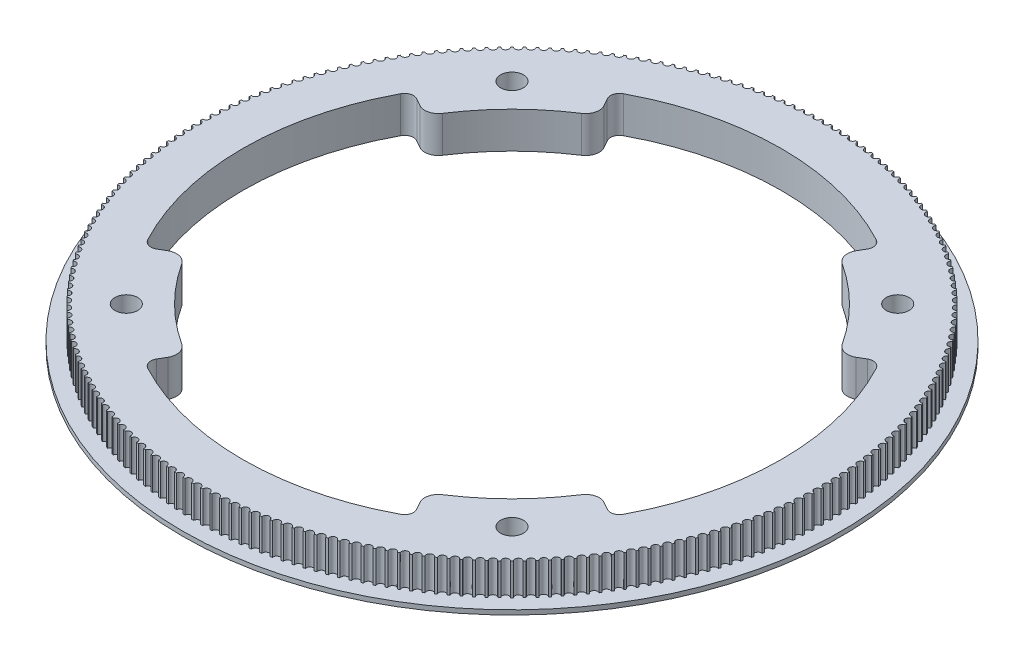
from build123d import *

# Parameters (mm, degrees)
BOSS_EXTRUDE1_DEPTH = 7
SKETCH3_R           = 72.5
BOSS_EXTRUDE3_DEPTH = 1
SKETCH6_R           = 2.5
CUT_EXTRUDE3_DEPTH  = 103.842111997
SKETCH7_R           = 50
CUT_EXTRUDE4_DEPTH  = 103.842111997
CUT_EXTRUDE5_DEPTH  = 103.842111997
SKETCH11_R          = 52.5
CUT_EXTRUDE6_DEPTH  = 10
FILLET1_R           = 3
FILLET2_R           = 2
SKETCH12_R          = 5
CUT_EXTRUDE7_DEPTH  = 3


with BuildPart() as part:
    # Sketch1 → Boss-Extrude1 (new body)
    with BuildSketch(Plane(origin=(0, 0, 0), x_dir=(1, 0, 0), z_dir=(0, 1, 0))):
        with BuildLine():
            ThreePointArc((-0.759988559, 69.250829904), (-0.988925477, 69.247938969), (-1.217851586, 69.244291191))
            ThreePointArc((-1.217851586, 69.244291191), (-1.955946699, 68.467067248), (-2.737208847, 69.200886647))
            ThreePointArc((-2.737208847, 69.200886647), (-2.965969848, 69.191459356), (-3.194698434, 69.18127584))
            ThreePointArc((-3.194698434, 69.18127584), (-3.9102981, 68.383291773), (-4.712196627, 69.094502154))
            ThreePointArc((-4.712196627, 69.094502154), (-4.940595132, 69.078546197), (-5.168939639, 69.061835249))
            ThreePointArc((-5.168939639, 69.061835249), (-5.861460206, 68.243741905), (-6.683341073, 68.931763195))
            ThreePointArc((-6.683341073, 68.931763195), (-6.911190796, 68.909291585), (-7.138964984, 68.886066835))
            ThreePointArc((-7.138964984, 68.886066835), (-7.80784162, 68.048531463), (-8.64903449, 68.7128025))
            ThreePointArc((-8.64903449, 68.7128025), (-8.876149594, 68.683833566), (-9.103167686, 68.654113956))
            ThreePointArc((-9.103167686, 68.654113956), (-9.747854848, 67.797819662), (-10.60767363, 68.437798658))
            ThreePointArc((-10.60767363, 68.437798658), (-10.833868876, 68.402356028), (-11.059945715, 68.366165797))
            ThreePointArc((-11.059945715, 68.366165797), (-11.679917584, 67.491810986), (-12.557660999, 68.106975966))
            ThreePointArc((-12.557660999, 68.106975966), (-12.7827519, 68.065088547), (-13.007703093, 68.022457213))
            ThreePointArc((-13.007703093, 68.022457213), (-13.602454013, 67.130755022), (-14.49740616, 67.720604247))
            ThreePointArc((-14.49740616, 67.720604247), (-14.721209128, 67.672306203), (-14.944851201, 67.623268537))
            ThreePointArc((-14.944851201, 67.623268537), (-15.513896085, 66.714946251), (-16.425327028, 67.278998633))
            ThreePointArc((-16.425327028, 67.278998633), (-16.647659527, 67.224329355), (-16.869810075, 67.168925353))
            ThreePointArc((-16.869810075, 67.168925353), (-17.412684801, 66.244723813), (-18.339851164, 66.782519302))
            ThreePointArc((-18.339851164, 66.782519302), (-18.560531855, 66.721523381), (-18.78100969, 66.65979823))
            ThreePointArc((-18.78100969, 66.65979823), (-19.297271481, 65.720471228), (-20.239417055, 66.23157119))
            ThreePointArc((-20.239417055, 66.23157119), (-20.458265948, 66.164298375), (-20.676891243, 66.096302419))
            ThreePointArc((-20.676891243, 66.096302419), (-21.16611903, 65.142616084), (-22.122475387, 65.626603659))
            ThreePointArc((-22.122475387, 65.626603659), (-22.339313986, 65.553108818), (-22.555908428, 65.478897517))
            ThreePointArc((-22.555908428, 65.478897517), (-23.017703188, 64.511629687), (-23.98749031, 64.968110128))
            ThreePointArc((-23.98749031, 64.968110128), (-24.202141758, 64.888453205), (-24.41652869, 64.808087086))
            ThreePointArc((-24.41652869, 64.808087086), (-24.850513778, 63.828026681), (-25.832940692, 64.256627675))
            ThreePointArc((-25.832940692, 64.256627675), (-26.045229917, 64.170873639), (-26.257234481, 64.08441825))
            ThreePointArc((-26.257234481, 64.08441825), (-26.663055932, 63.09236462), (-27.657321357, 63.492736595))
            ThreePointArc((-27.657321357, 63.492736595), (-27.867075212, 63.400955388), (-28.076524495, 63.308481243))
            ThreePointArc((-28.076524495, 63.308481243), (-28.453851316, 62.305243522), (-29.459144315, 62.677059928))
            ThreePointArc((-29.459144315, 62.677059928), (-29.666191722, 62.579326408), (-29.872914893, 62.48090893))
            ThreePointArc((-29.872914893, 62.48090893), (-30.22143933, 61.467305373), (-31.236939971, 61.810262952))
            ThreePointArc((-31.236939971, 61.810262952), (-31.441112059, 61.706656833), (-31.644940513, 61.602376293))
            ThreePointArc((-31.644940513, 61.602376293), (-31.964378304, 60.579233609), (-32.989258331, 60.893052639))
            ThreePointArc((-32.989258331, 60.893052639), (-33.190388575, 60.783658422), (-33.391156066, 60.673599873))
            ThreePointArc((-33.391156066, 60.673599873), (-33.681246674, 59.641752552), (-34.71467018, 59.926177079))
            ThreePointArc((-34.71467018, 59.926177079), (-34.912594534, 59.811083989), (-35.110137313, 59.695337195))
            ThreePointArc((-35.110137313, 59.695337195), (-35.370644135, 58.655626827), (-36.411768245, 58.910424869))
            ThreePointArc((-36.411768245, 58.910424869), (-36.60632528, 58.789726777), (-36.800482228, 58.668386144))
            ThreePointArc((-36.800482228, 58.668386144), (-37.031192792, 57.621660731), (-38.079168349, 57.846624472))
            ThreePointArc((-38.079168349, 57.846624472), (-38.270199382, 57.72041982), (-38.460812142, 57.593584316))
            ThreePointArc((-38.460812142, 57.593584316), (-38.661538276, 56.540697582), (-39.715510538, 56.735643538))
            ThreePointArc((-39.715510538, 56.735643538), (-39.902859761, 56.604035262), (-40.089772867, 56.471808334))
            ThreePointArc((-40.089772867, 56.471808334), (-40.260350856, 55.41361903), (-41.319460187, 55.5783882))
            ThreePointArc((-41.319460187, 55.5783882), (-41.502974794, 55.44148364), (-41.686035797, 55.303973135))
            ThreePointArc((-41.686035797, 55.303973135), (-41.826326516, 54.241344334), (-42.889709091, 54.375802331))
            ThreePointArc((-42.889709091, 54.375802331), (-43.069239406, 54.233713149), (-43.248298998, 54.091031223))
            ThreePointArc((-43.248298998, 54.091031223), (-43.358188024, 53.024829621), (-44.424976533, 53.128866777))
            ThreePointArc((-44.424976533, 53.128866777), (-44.600376129, 52.981708864), (-44.775288267, 52.833971889))
            ThreePointArc((-44.775288267, 52.833971889), (-44.854685972, 51.765067095), (-45.924010327, 51.838598558))
            ThreePointArc((-45.924010327, 51.838598558), (-46.095136145, 51.686491937), (-46.265758168, 51.533820411))
            ThreePointArc((-46.265758168, 51.533820411), (-46.314599794, 50.463084239), (-47.38558784, 50.506050034))
            ThreePointArc((-47.38558784, 50.506050034), (-47.552300307, 50.349118766), (-47.718493053, 50.191637209))
            ThreePointArc((-47.718493053, 50.191637209), (-47.736738765, 49.119942967), (-48.808516988, 49.132308051))
            ThreePointArc((-48.808516988, 49.132308051), (-48.970680131, 48.970680131), (-49.132308051, 48.808516988))
            ThreePointArc((-49.132308051, 48.808516988), (-49.119942967, 47.736738765), (-50.191637209, 47.718493053))
            ThreePointArc((-50.191637209, 47.718493053), (-50.349118766, 47.552300307), (-50.506050034, 47.38558784))
            ThreePointArc((-50.506050034, 47.38558784), (-50.463084239, 46.314599794), (-51.533820411, 46.265758168))
            ThreePointArc((-51.533820411, 46.265758168), (-51.686491937, 46.095136145), (-51.838598558, 45.924010327))
            ThreePointArc((-51.838598558, 45.924010327), (-51.765067095, 44.854685972), (-52.833971889, 44.775288267))
            ThreePointArc((-52.833971889, 44.775288267), (-52.981708864, 44.600376129), (-53.128866777, 44.424976533))
            ThreePointArc((-53.128866777, 44.424976533), (-53.024829621, 43.358188024), (-54.091031223, 43.248298998))
            ThreePointArc((-54.091031223, 43.248298998), (-54.233713149, 43.069239406), (-54.375802331, 42.889709091))
            ThreePointArc((-54.375802331, 42.889709091), (-54.241344334, 41.826326516), (-55.303973135, 41.686035797))
            ThreePointArc((-55.303973135, 41.686035797), (-55.44148364, 41.502974794), (-55.5783882, 41.319460187))
            ThreePointArc((-55.5783882, 41.319460187), (-55.41361903, 40.260350856), (-56.471808334, 40.089772867))
            ThreePointArc((-56.471808334, 40.089772867), (-56.604035262, 39.902859761), (-56.735643538, 39.715510538))
            ThreePointArc((-56.735643538, 39.715510538), (-56.540697582, 38.661538276), (-57.593584316, 38.460812142))
            ThreePointArc((-57.593584316, 38.460812142), (-57.72041982, 38.270199382), (-57.846624472, 38.079168349))
            ThreePointArc((-57.846624472, 38.079168349), (-57.621660731, 37.031192792), (-58.668386144, 36.800482228))
            ThreePointArc((-58.668386144, 36.800482228), (-58.789726777, 36.60632528), (-58.910424869, 36.411768245))
            ThreePointArc((-58.910424869, 36.411768245), (-58.655626827, 35.370644135), (-59.695337195, 35.110137313))
            ThreePointArc((-59.695337195, 35.110137313), (-59.811083989, 34.912594534), (-59.926177079, 34.71467018))
            ThreePointArc((-59.926177079, 34.71467018), (-59.641752552, 33.681246674), (-60.673599873, 33.391156066))
            ThreePointArc((-60.673599873, 33.391156066), (-60.783658422, 33.190388575), (-60.893052639, 32.989258331))
            ThreePointArc((-60.893052639, 32.989258331), (-60.579233609, 31.964378304), (-61.602376293, 31.644940513))
            ThreePointArc((-61.602376293, 31.644940513), (-61.706656833, 31.441112059), (-61.810262952, 31.236939971))
            ThreePointArc((-61.810262952, 31.236939971), (-61.467305373, 30.22143933), (-62.48090893, 29.872914893))
            ThreePointArc((-62.48090893, 29.872914893), (-62.579326408, 29.666191722), (-62.677059928, 29.459144315))
            ThreePointArc((-62.677059928, 29.459144315), (-62.305243522, 28.453851316), (-63.308481243, 28.076524495))
            ThreePointArc((-63.308481243, 28.076524495), (-63.400955388, 27.867075212), (-63.492736595, 27.657321357))
            ThreePointArc((-63.492736595, 27.657321357), (-63.09236462, 26.663055932), (-64.08441825, 26.257234481))
            ThreePointArc((-64.08441825, 26.257234481), (-64.170873639, 26.045229917), (-64.256627675, 25.832940692))
            ThreePointArc((-64.256627675, 25.832940692), (-63.828026681, 24.850513778), (-64.808087086, 24.41652869))
            ThreePointArc((-64.808087086, 24.41652869), (-64.888453205, 24.202141758), (-64.968110128, 23.98749031))
            ThreePointArc((-64.968110128, 23.98749031), (-64.511629687, 23.017703188), (-65.478897517, 22.555908428))
            ThreePointArc((-65.478897517, 22.555908428), (-65.553108818, 22.339313986), (-65.626603659, 22.122475387))
            ThreePointArc((-65.626603659, 22.122475387), (-65.142616084, 21.16611903), (-66.096302419, 20.676891243))
            ThreePointArc((-66.096302419, 20.676891243), (-66.164298375, 20.458265948), (-66.23157119, 20.239417055))
            ThreePointArc((-66.23157119, 20.239417055), (-65.720471228, 19.297271481), (-66.65979823, 18.78100969))
            ThreePointArc((-66.65979823, 18.78100969), (-66.721523381, 18.560531855), (-66.782519302, 18.339851164))
            ThreePointArc((-66.782519302, 18.339851164), (-66.244723813, 17.412684801), (-67.168925353, 16.869810075))
            ThreePointArc((-67.168925353, 16.869810075), (-67.224329355, 16.647659527), (-67.278998633, 16.425327028))
            ThreePointArc((-67.278998633, 16.425327028), (-66.714946251, 15.513896085), (-67.623268537, 14.944851201))
            ThreePointArc((-67.623268537, 14.944851201), (-67.672306203, 14.721209128), (-67.720604247, 14.49740616))
            ThreePointArc((-67.720604247, 14.49740616), (-67.130755022, 13.602454013), (-68.022457213, 13.007703093))
            ThreePointArc((-68.022457213, 13.007703093), (-68.065088547, 12.7827519), (-68.106975966, 12.557660999))
            ThreePointArc((-68.106975966, 12.557660999), (-67.491810986, 11.679917584), (-68.366165797, 11.059945715))
            ThreePointArc((-68.366165797, 11.059945715), (-68.402356028, 10.833868876), (-68.437798658, 10.60767363))
            ThreePointArc((-68.437798658, 10.60767363), (-67.797819662, 9.747854848), (-68.654113956, 9.103167686))
            ThreePointArc((-68.654113956, 9.103167686), (-68.683833566, 8.876149594), (-68.7128025, 8.64903449))
            ThreePointArc((-68.7128025, 8.64903449), (-68.048531463, 7.80784162), (-68.886066835, 7.138964984))
            ThreePointArc((-68.886066835, 7.138964984), (-68.909291585, 6.911190796), (-68.931763195, 6.683341073))
            ThreePointArc((-68.931763195, 6.683341073), (-68.243741905, 5.861460206), (-69.061835249, 5.168939639))
            ThreePointArc((-69.061835249, 5.168939639), (-69.078546197, 4.940595132), (-69.094502154, 4.712196627))
            ThreePointArc((-69.094502154, 4.712196627), (-68.383291773, 3.9102981), (-69.18127584, 3.194698434))
            ThreePointArc((-69.18127584, 3.194698434), (-69.191459356, 2.965969848), (-69.200886647, 2.737208847))
            ThreePointArc((-69.200886647, 2.737208847), (-68.467067248, 1.955946699), (-69.244291191, 1.217851586))
            ThreePointArc((-69.244291191, 1.217851586), (-69.247938969, 0.988925477), (-69.250829904, 0.759988559))
            ThreePointArc((-69.250829904, 0.759988559), (-68.495, 0), (-69.250829904, -0.759988559))
            ThreePointArc((-69.250829904, -0.759988559), (-69.247938969, -0.988925477), (-69.244291191, -1.217851586))
            ThreePointArc((-69.244291191, -1.217851586), (-68.467067248, -1.955946699), (-69.200886647, -2.737208847))
            ThreePointArc((-69.200886647, -2.737208847), (-69.191459356, -2.965969848), (-69.18127584, -3.194698434))
            ThreePointArc((-69.18127584, -3.194698434), (-68.383291773, -3.9102981), (-69.094502154, -4.712196627))
            ThreePointArc((-69.094502154, -4.712196627), (-69.078546197, -4.940595132), (-69.061835249, -5.168939639))
            ThreePointArc((-69.061835249, -5.168939639), (-68.243741905, -5.861460206), (-68.931763195, -6.683341073))
            ThreePointArc((-68.931763195, -6.683341073), (-68.909291585, -6.911190796), (-68.886066835, -7.138964984))
            ThreePointArc((-68.886066835, -7.138964984), (-68.048531463, -7.80784162), (-68.7128025, -8.64903449))
            ThreePointArc((-68.7128025, -8.64903449), (-68.683833566, -8.876149594), (-68.654113956, -9.103167686))
            ThreePointArc((-68.654113956, -9.103167686), (-67.797819662, -9.747854848), (-68.437798658, -10.60767363))
            ThreePointArc((-68.437798658, -10.60767363), (-68.402356028, -10.833868876), (-68.366165797, -11.059945715))
            ThreePointArc((-68.366165797, -11.059945715), (-67.491810986, -11.679917584), (-68.106975966, -12.557660999))
            ThreePointArc((-68.106975966, -12.557660999), (-68.065088547, -12.7827519), (-68.022457213, -13.007703093))
            ThreePointArc((-68.022457213, -13.007703093), (-67.130755022, -13.602454013), (-67.720604247, -14.49740616))
            ThreePointArc((-67.720604247, -14.49740616), (-67.672306203, -14.721209128), (-67.623268537, -14.944851201))
            ThreePointArc((-67.623268537, -14.944851201), (-66.714946251, -15.513896085), (-67.278998633, -16.425327028))
            ThreePointArc((-67.278998633, -16.425327028), (-67.224329355, -16.647659527), (-67.168925353, -16.869810075))
            ThreePointArc((-67.168925353, -16.869810075), (-66.244723813, -17.412684801), (-66.782519302, -18.339851164))
            ThreePointArc((-66.782519302, -18.339851164), (-66.721523381, -18.560531855), (-66.65979823, -18.78100969))
            ThreePointArc((-66.65979823, -18.78100969), (-65.720471228, -19.297271481), (-66.23157119, -20.239417055))
            ThreePointArc((-66.23157119, -20.239417055), (-66.164298375, -20.458265948), (-66.096302419, -20.676891243))
            ThreePointArc((-66.096302419, -20.676891243), (-65.142616084, -21.16611903), (-65.626603659, -22.122475387))
            ThreePointArc((-65.626603659, -22.122475387), (-65.553108818, -22.339313986), (-65.478897517, -22.555908428))
            ThreePointArc((-65.478897517, -22.555908428), (-64.511629687, -23.017703188), (-64.968110128, -23.98749031))
            ThreePointArc((-64.968110128, -23.98749031), (-64.888453205, -24.202141758), (-64.808087086, -24.41652869))
            ThreePointArc((-64.808087086, -24.41652869), (-63.828026681, -24.850513778), (-64.256627675, -25.832940692))
            ThreePointArc((-64.256627675, -25.832940692), (-64.170873639, -26.045229917), (-64.08441825, -26.257234481))
            ThreePointArc((-64.08441825, -26.257234481), (-63.09236462, -26.663055932), (-63.492736595, -27.657321357))
            ThreePointArc((-63.492736595, -27.657321357), (-63.400955388, -27.867075212), (-63.308481243, -28.076524495))
            ThreePointArc((-63.308481243, -28.076524495), (-62.305243522, -28.453851316), (-62.677059928, -29.459144315))
            ThreePointArc((-62.677059928, -29.459144315), (-62.579326408, -29.666191722), (-62.48090893, -29.872914893))
            ThreePointArc((-62.48090893, -29.872914893), (-61.467305373, -30.22143933), (-61.810262952, -31.236939971))
            ThreePointArc((-61.810262952, -31.236939971), (-61.706656833, -31.441112059), (-61.602376293, -31.644940513))
            ThreePointArc((-61.602376293, -31.644940513), (-60.579233609, -31.964378304), (-60.893052639, -32.989258331))
            ThreePointArc((-60.893052639, -32.989258331), (-60.783658422, -33.190388575), (-60.673599873, -33.391156066))
            ThreePointArc((-60.673599873, -33.391156066), (-59.641752552, -33.681246674), (-59.926177079, -34.71467018))
            ThreePointArc((-59.926177079, -34.71467018), (-59.811083989, -34.912594534), (-59.695337195, -35.110137313))
            ThreePointArc((-59.695337195, -35.110137313), (-58.655626827, -35.370644135), (-58.910424869, -36.411768245))
            ThreePointArc((-58.910424869, -36.411768245), (-58.789726777, -36.60632528), (-58.668386144, -36.800482228))
            ThreePointArc((-58.668386144, -36.800482228), (-57.621660731, -37.031192792), (-57.846624472, -38.079168349))
            ThreePointArc((-57.846624472, -38.079168349), (-57.72041982, -38.270199382), (-57.593584316, -38.460812142))
            ThreePointArc((-57.593584316, -38.460812142), (-56.540697582, -38.661538276), (-56.735643538, -39.715510538))
            ThreePointArc((-56.735643538, -39.715510538), (-56.604035262, -39.902859761), (-56.471808334, -40.089772867))
            ThreePointArc((-56.471808334, -40.089772867), (-55.41361903, -40.260350856), (-55.5783882, -41.319460187))
            ThreePointArc((-55.5783882, -41.319460187), (-55.44148364, -41.502974794), (-55.303973135, -41.686035797))
            ThreePointArc((-55.303973135, -41.686035797), (-54.241344334, -41.826326516), (-54.375802331, -42.889709091))
            ThreePointArc((-54.375802331, -42.889709091), (-54.233713149, -43.069239406), (-54.091031223, -43.248298998))
            ThreePointArc((-54.091031223, -43.248298998), (-53.024829621, -43.358188024), (-53.128866777, -44.424976533))
            ThreePointArc((-53.128866777, -44.424976533), (-52.981708864, -44.600376129), (-52.833971889, -44.775288267))
            ThreePointArc((-52.833971889, -44.775288267), (-51.765067095, -44.854685972), (-51.838598558, -45.924010327))
            ThreePointArc((-51.838598558, -45.924010327), (-51.686491937, -46.095136145), (-51.533820411, -46.265758168))
            ThreePointArc((-51.533820411, -46.265758168), (-50.463084239, -46.314599794), (-50.506050034, -47.38558784))
            ThreePointArc((-50.506050034, -47.38558784), (-50.349118766, -47.552300307), (-50.191637209, -47.718493053))
            ThreePointArc((-50.191637209, -47.718493053), (-49.119942967, -47.736738765), (-49.132308051, -48.808516988))
            ThreePointArc((-49.132308051, -48.808516988), (-48.970680131, -48.970680131), (-48.808516988, -49.132308051))
            ThreePointArc((-48.808516988, -49.132308051), (-47.736738765, -49.119942967), (-47.718493053, -50.191637209))
            ThreePointArc((-47.718493053, -50.191637209), (-47.552300307, -50.349118766), (-47.38558784, -50.506050034))
            ThreePointArc((-47.38558784, -50.506050034), (-46.314599794, -50.463084239), (-46.265758168, -51.533820411))
            ThreePointArc((-46.265758168, -51.533820411), (-46.095136145, -51.686491937), (-45.924010327, -51.838598558))
            ThreePointArc((-45.924010327, -51.838598558), (-44.854685972, -51.765067095), (-44.775288267, -52.833971889))
            ThreePointArc((-44.775288267, -52.833971889), (-44.600376129, -52.981708864), (-44.424976533, -53.128866777))
            ThreePointArc((-44.424976533, -53.128866777), (-43.358188024, -53.024829621), (-43.248298998, -54.091031223))
            ThreePointArc((-43.248298998, -54.091031223), (-43.069239406, -54.233713149), (-42.889709091, -54.375802331))
            ThreePointArc((-42.889709091, -54.375802331), (-41.826326516, -54.241344334), (-41.686035797, -55.303973135))
            ThreePointArc((-41.686035797, -55.303973135), (-41.502974794, -55.44148364), (-41.319460187, -55.5783882))
            ThreePointArc((-41.319460187, -55.5783882), (-40.260350856, -55.41361903), (-40.089772867, -56.471808334))
            ThreePointArc((-40.089772867, -56.471808334), (-39.902859761, -56.604035262), (-39.715510538, -56.735643538))
            ThreePointArc((-39.715510538, -56.735643538), (-38.661538276, -56.540697582), (-38.460812142, -57.593584316))
            ThreePointArc((-38.460812142, -57.593584316), (-38.270199382, -57.72041982), (-38.079168349, -57.846624472))
            ThreePointArc((-38.079168349, -57.846624472), (-37.031192792, -57.621660731), (-36.800482228, -58.668386144))
            ThreePointArc((-36.800482228, -58.668386144), (-36.60632528, -58.789726777), (-36.411768245, -58.910424869))
            ThreePointArc((-36.411768245, -58.910424869), (-35.370644135, -58.655626827), (-35.110137313, -59.695337195))
            ThreePointArc((-35.110137313, -59.695337195), (-34.912594534, -59.811083989), (-34.71467018, -59.926177079))
            ThreePointArc((-34.71467018, -59.926177079), (-33.681246674, -59.641752552), (-33.391156066, -60.673599873))
            ThreePointArc((-33.391156066, -60.673599873), (-33.190388575, -60.783658422), (-32.989258331, -60.893052639))
            ThreePointArc((-32.989258331, -60.893052639), (-31.964378304, -60.579233609), (-31.644940513, -61.602376293))
            ThreePointArc((-31.644940513, -61.602376293), (-31.441112059, -61.706656833), (-31.236939971, -61.810262952))
            ThreePointArc((-31.236939971, -61.810262952), (-30.22143933, -61.467305373), (-29.872914893, -62.48090893))
            ThreePointArc((-29.872914893, -62.48090893), (-29.666191722, -62.579326408), (-29.459144315, -62.677059928))
            ThreePointArc((-29.459144315, -62.677059928), (-28.453851316, -62.305243522), (-28.076524495, -63.308481243))
            ThreePointArc((-28.076524495, -63.308481243), (-27.867075212, -63.400955388), (-27.657321357, -63.492736595))
            ThreePointArc((-27.657321357, -63.492736595), (-26.663055932, -63.09236462), (-26.257234481, -64.08441825))
            ThreePointArc((-26.257234481, -64.08441825), (-26.045229917, -64.170873639), (-25.832940692, -64.256627675))
            ThreePointArc((-25.832940692, -64.256627675), (-24.850513778, -63.828026681), (-24.41652869, -64.808087086))
            ThreePointArc((-24.41652869, -64.808087086), (-24.202141758, -64.888453205), (-23.98749031, -64.968110128))
            ThreePointArc((-23.98749031, -64.968110128), (-23.017703188, -64.511629687), (-22.555908428, -65.478897517))
            ThreePointArc((-22.555908428, -65.478897517), (-22.339313986, -65.553108818), (-22.122475387, -65.626603659))
            ThreePointArc((-22.122475387, -65.626603659), (-21.16611903, -65.142616084), (-20.676891243, -66.096302419))
            ThreePointArc((-20.676891243, -66.096302419), (-20.458265948, -66.164298375), (-20.239417055, -66.23157119))
            ThreePointArc((-20.239417055, -66.23157119), (-19.297271481, -65.720471228), (-18.78100969, -66.65979823))
            ThreePointArc((-18.78100969, -66.65979823), (-18.560531855, -66.721523381), (-18.339851164, -66.782519302))
            ThreePointArc((-18.339851164, -66.782519302), (-17.412684801, -66.244723813), (-16.869810075, -67.168925353))
            ThreePointArc((-16.869810075, -67.168925353), (-16.647659527, -67.224329355), (-16.425327028, -67.278998633))
            ThreePointArc((-16.425327028, -67.278998633), (-15.513896085, -66.714946251), (-14.944851201, -67.623268537))
            ThreePointArc((-14.944851201, -67.623268537), (-14.721209128, -67.672306203), (-14.49740616, -67.720604247))
            ThreePointArc((-14.49740616, -67.720604247), (-13.602454013, -67.130755022), (-13.007703093, -68.022457213))
            ThreePointArc((-13.007703093, -68.022457213), (-12.7827519, -68.065088547), (-12.557660999, -68.106975966))
            ThreePointArc((-12.557660999, -68.106975966), (-11.679917584, -67.491810986), (-11.059945715, -68.366165797))
            ThreePointArc((-11.059945715, -68.366165797), (-10.833868876, -68.402356028), (-10.60767363, -68.437798658))
            ThreePointArc((-10.60767363, -68.437798658), (-9.747854848, -67.797819662), (-9.103167686, -68.654113956))
            ThreePointArc((-9.103167686, -68.654113956), (-8.876149594, -68.683833566), (-8.64903449, -68.7128025))
            ThreePointArc((-8.64903449, -68.7128025), (-7.80784162, -68.048531463), (-7.138964984, -68.886066835))
            ThreePointArc((-7.138964984, -68.886066835), (-6.911190796, -68.909291585), (-6.683341073, -68.931763195))
            ThreePointArc((-6.683341073, -68.931763195), (-5.861460206, -68.243741905), (-5.168939639, -69.061835249))
            ThreePointArc((-5.168939639, -69.061835249), (-4.940595132, -69.078546197), (-4.712196627, -69.094502154))
            ThreePointArc((-4.712196627, -69.094502154), (-3.9102981, -68.383291773), (-3.194698434, -69.18127584))
            ThreePointArc((-3.194698434, -69.18127584), (-2.965969848, -69.191459356), (-2.737208847, -69.200886647))
            ThreePointArc((-2.737208847, -69.200886647), (-1.955946699, -68.467067248), (-1.217851586, -69.244291191))
            ThreePointArc((-1.217851586, -69.244291191), (-0.988925477, -69.247938969), (-0.759988559, -69.250829904))
            ThreePointArc((-0.759988559, -69.250829904), (0, -68.495), (0.759988559, -69.250829904))
            ThreePointArc((0.759988559, -69.250829904), (0.988925477, -69.247938969), (1.217851586, -69.244291191))
            ThreePointArc((1.217851586, -69.244291191), (1.955946699, -68.467067248), (2.737208847, -69.200886647))
            ThreePointArc((2.737208847, -69.200886647), (2.965969848, -69.191459356), (3.194698434, -69.18127584))
            ThreePointArc((3.194698434, -69.18127584), (3.9102981, -68.383291773), (4.712196627, -69.094502154))
            ThreePointArc((4.712196627, -69.094502154), (4.940595132, -69.078546197), (5.168939639, -69.061835249))
            ThreePointArc((5.168939639, -69.061835249), (5.861460206, -68.243741905), (6.683341073, -68.931763195))
            ThreePointArc((6.683341073, -68.931763195), (6.911190796, -68.909291585), (7.138964984, -68.886066835))
            ThreePointArc((7.138964984, -68.886066835), (7.80784162, -68.048531463), (8.64903449, -68.7128025))
            ThreePointArc((8.64903449, -68.7128025), (8.876149594, -68.683833566), (9.103167686, -68.654113956))
            ThreePointArc((9.103167686, -68.654113956), (9.747854848, -67.797819662), (10.60767363, -68.437798658))
            ThreePointArc((10.60767363, -68.437798658), (10.833868876, -68.402356028), (11.059945715, -68.366165797))
            ThreePointArc((11.059945715, -68.366165797), (11.679917584, -67.491810986), (12.557660999, -68.106975966))
            ThreePointArc((12.557660999, -68.106975966), (12.7827519, -68.065088547), (13.007703093, -68.022457213))
            ThreePointArc((13.007703093, -68.022457213), (13.602454013, -67.130755022), (14.49740616, -67.720604247))
            ThreePointArc((14.49740616, -67.720604247), (14.721209128, -67.672306203), (14.944851201, -67.623268537))
            ThreePointArc((14.944851201, -67.623268537), (15.513896085, -66.714946251), (16.425327028, -67.278998633))
            ThreePointArc((16.425327028, -67.278998633), (16.647659527, -67.224329355), (16.869810075, -67.168925353))
            ThreePointArc((16.869810075, -67.168925353), (17.412684801, -66.244723813), (18.339851164, -66.782519302))
            ThreePointArc((18.339851164, -66.782519302), (18.560531855, -66.721523381), (18.78100969, -66.65979823))
            ThreePointArc((18.78100969, -66.65979823), (19.297271481, -65.720471228), (20.239417055, -66.23157119))
            ThreePointArc((20.239417055, -66.23157119), (20.458265948, -66.164298375), (20.676891243, -66.096302419))
            ThreePointArc((20.676891243, -66.096302419), (21.16611903, -65.142616084), (22.122475387, -65.626603659))
            ThreePointArc((22.122475387, -65.626603659), (22.339313986, -65.553108818), (22.555908428, -65.478897517))
            ThreePointArc((22.555908428, -65.478897517), (23.017703188, -64.511629687), (23.98749031, -64.968110128))
            ThreePointArc((23.98749031, -64.968110128), (24.202141758, -64.888453205), (24.41652869, -64.808087086))
            ThreePointArc((24.41652869, -64.808087086), (24.850513778, -63.828026681), (25.832940692, -64.256627675))
            ThreePointArc((25.832940692, -64.256627675), (26.045229917, -64.170873639), (26.257234481, -64.08441825))
            ThreePointArc((26.257234481, -64.08441825), (26.663055932, -63.09236462), (27.657321357, -63.492736595))
            ThreePointArc((27.657321357, -63.492736595), (27.867075212, -63.400955388), (28.076524495, -63.308481243))
            ThreePointArc((28.076524495, -63.308481243), (28.453851316, -62.305243522), (29.459144315, -62.677059928))
            ThreePointArc((29.459144315, -62.677059928), (29.666191722, -62.579326408), (29.872914893, -62.48090893))
            ThreePointArc((29.872914893, -62.48090893), (30.22143933, -61.467305373), (31.236939971, -61.810262952))
            ThreePointArc((31.236939971, -61.810262952), (31.441112059, -61.706656833), (31.644940513, -61.602376293))
            ThreePointArc((31.644940513, -61.602376293), (31.964378304, -60.579233609), (32.989258331, -60.893052639))
            ThreePointArc((32.989258331, -60.893052639), (33.190388575, -60.783658422), (33.391156066, -60.673599873))
            ThreePointArc((33.391156066, -60.673599873), (33.681246674, -59.641752552), (34.71467018, -59.926177079))
            ThreePointArc((34.71467018, -59.926177079), (34.912594534, -59.811083989), (35.110137313, -59.695337195))
            ThreePointArc((35.110137313, -59.695337195), (35.370644135, -58.655626827), (36.411768245, -58.910424869))
            ThreePointArc((36.411768245, -58.910424869), (36.60632528, -58.789726777), (36.800482228, -58.668386144))
            ThreePointArc((36.800482228, -58.668386144), (37.031192792, -57.621660731), (38.079168349, -57.846624472))
            ThreePointArc((38.079168349, -57.846624472), (38.270199382, -57.72041982), (38.460812142, -57.593584316))
            ThreePointArc((38.460812142, -57.593584316), (38.661538276, -56.540697582), (39.715510538, -56.735643538))
            ThreePointArc((39.715510538, -56.735643538), (39.902859761, -56.604035262), (40.089772867, -56.471808334))
            ThreePointArc((40.089772867, -56.471808334), (40.260350856, -55.41361903), (41.319460187, -55.5783882))
            ThreePointArc((41.319460187, -55.5783882), (41.502974794, -55.44148364), (41.686035797, -55.303973135))
            ThreePointArc((41.686035797, -55.303973135), (41.826326516, -54.241344334), (42.889709091, -54.375802331))
            ThreePointArc((42.889709091, -54.375802331), (43.069239406, -54.233713149), (43.248298998, -54.091031223))
            ThreePointArc((43.248298998, -54.091031223), (43.358188024, -53.024829621), (44.424976533, -53.128866777))
            ThreePointArc((44.424976533, -53.128866777), (44.600376129, -52.981708864), (44.775288267, -52.833971889))
            ThreePointArc((44.775288267, -52.833971889), (44.854685972, -51.765067095), (45.924010327, -51.838598558))
            ThreePointArc((45.924010327, -51.838598558), (46.095136145, -51.686491937), (46.265758168, -51.533820411))
            ThreePointArc((46.265758168, -51.533820411), (46.314599794, -50.463084239), (47.38558784, -50.506050034))
            ThreePointArc((47.38558784, -50.506050034), (47.552300307, -50.349118766), (47.718493053, -50.191637209))
            ThreePointArc((47.718493053, -50.191637209), (47.736738765, -49.119942967), (48.808516988, -49.132308051))
            ThreePointArc((48.808516988, -49.132308051), (48.970680131, -48.970680131), (49.132308051, -48.808516988))
            ThreePointArc((49.132308051, -48.808516988), (49.119942967, -47.736738765), (50.191637209, -47.718493053))
            ThreePointArc((50.191637209, -47.718493053), (50.349118766, -47.552300307), (50.506050034, -47.38558784))
            ThreePointArc((50.506050034, -47.38558784), (50.463084239, -46.314599794), (51.533820411, -46.265758168))
            ThreePointArc((51.533820411, -46.265758168), (51.686491937, -46.095136145), (51.838598558, -45.924010327))
            ThreePointArc((51.838598558, -45.924010327), (51.765067095, -44.854685972), (52.833971889, -44.775288267))
            ThreePointArc((52.833971889, -44.775288267), (52.981708864, -44.600376129), (53.128866777, -44.424976533))
            ThreePointArc((53.128866777, -44.424976533), (53.024829621, -43.358188024), (54.091031223, -43.248298998))
            ThreePointArc((54.091031223, -43.248298998), (54.233713149, -43.069239406), (54.375802331, -42.889709091))
            ThreePointArc((54.375802331, -42.889709091), (54.241344334, -41.826326516), (55.303973135, -41.686035797))
            ThreePointArc((55.303973135, -41.686035797), (55.44148364, -41.502974794), (55.5783882, -41.319460187))
            ThreePointArc((55.5783882, -41.319460187), (55.41361903, -40.260350856), (56.471808334, -40.089772867))
            ThreePointArc((56.471808334, -40.089772867), (56.604035262, -39.902859761), (56.735643538, -39.715510538))
            ThreePointArc((56.735643538, -39.715510538), (56.540697582, -38.661538276), (57.593584316, -38.460812142))
            ThreePointArc((57.593584316, -38.460812142), (57.72041982, -38.270199382), (57.846624472, -38.079168349))
            ThreePointArc((57.846624472, -38.079168349), (57.621660731, -37.031192792), (58.668386144, -36.800482228))
            ThreePointArc((58.668386144, -36.800482228), (58.789726777, -36.60632528), (58.910424869, -36.411768245))
            ThreePointArc((58.910424869, -36.411768245), (58.655626827, -35.370644135), (59.695337195, -35.110137313))
            ThreePointArc((59.695337195, -35.110137313), (59.811083989, -34.912594534), (59.926177079, -34.71467018))
            ThreePointArc((59.926177079, -34.71467018), (59.641752552, -33.681246674), (60.673599873, -33.391156066))
            ThreePointArc((60.673599873, -33.391156066), (60.783658422, -33.190388575), (60.893052639, -32.989258331))
            ThreePointArc((60.893052639, -32.989258331), (60.579233609, -31.964378304), (61.602376293, -31.644940513))
            ThreePointArc((61.602376293, -31.644940513), (61.706656833, -31.441112059), (61.810262952, -31.236939971))
            ThreePointArc((61.810262952, -31.236939971), (61.467305373, -30.22143933), (62.48090893, -29.872914893))
            ThreePointArc((62.48090893, -29.872914893), (62.579326408, -29.666191722), (62.677059928, -29.459144315))
            ThreePointArc((62.677059928, -29.459144315), (62.305243522, -28.453851316), (63.308481243, -28.076524495))
            ThreePointArc((63.308481243, -28.076524495), (63.400955388, -27.867075212), (63.492736595, -27.657321357))
            ThreePointArc((63.492736595, -27.657321357), (63.09236462, -26.663055932), (64.08441825, -26.257234481))
            ThreePointArc((64.08441825, -26.257234481), (64.170873639, -26.045229917), (64.256627675, -25.832940692))
            ThreePointArc((64.256627675, -25.832940692), (63.828026681, -24.850513778), (64.808087086, -24.41652869))
            ThreePointArc((64.808087086, -24.41652869), (64.888453205, -24.202141758), (64.968110128, -23.98749031))
            ThreePointArc((64.968110128, -23.98749031), (64.511629687, -23.017703188), (65.478897517, -22.555908428))
            ThreePointArc((65.478897517, -22.555908428), (65.553108818, -22.339313986), (65.626603659, -22.122475387))
            ThreePointArc((65.626603659, -22.122475387), (65.142616084, -21.16611903), (66.096302419, -20.676891243))
            ThreePointArc((66.096302419, -20.676891243), (66.164298375, -20.458265948), (66.23157119, -20.239417055))
            ThreePointArc((66.23157119, -20.239417055), (65.720471228, -19.297271481), (66.65979823, -18.78100969))
            ThreePointArc((66.65979823, -18.78100969), (66.721523381, -18.560531855), (66.782519302, -18.339851164))
            ThreePointArc((66.782519302, -18.339851164), (66.244723813, -17.412684801), (67.168925353, -16.869810075))
            ThreePointArc((67.168925353, -16.869810075), (67.224329355, -16.647659527), (67.278998633, -16.425327028))
            ThreePointArc((67.278998633, -16.425327028), (66.714946251, -15.513896085), (67.623268537, -14.944851201))
            ThreePointArc((67.623268537, -14.944851201), (67.672306203, -14.721209128), (67.720604247, -14.49740616))
            ThreePointArc((67.720604247, -14.49740616), (67.130755022, -13.602454013), (68.022457213, -13.007703093))
            ThreePointArc((68.022457213, -13.007703093), (68.065088547, -12.7827519), (68.106975966, -12.557660999))
            ThreePointArc((68.106975966, -12.557660999), (67.491810986, -11.679917584), (68.366165797, -11.059945715))
            ThreePointArc((68.366165797, -11.059945715), (68.402356028, -10.833868876), (68.437798658, -10.60767363))
            ThreePointArc((68.437798658, -10.60767363), (67.797819662, -9.747854848), (68.654113956, -9.103167686))
            ThreePointArc((68.654113956, -9.103167686), (68.683833566, -8.876149594), (68.7128025, -8.64903449))
            ThreePointArc((68.7128025, -8.64903449), (68.048531463, -7.80784162), (68.886066835, -7.138964984))
            ThreePointArc((68.886066835, -7.138964984), (68.909291585, -6.911190796), (68.931763195, -6.683341073))
            ThreePointArc((68.931763195, -6.683341073), (68.243741905, -5.861460206), (69.061835249, -5.168939639))
            ThreePointArc((69.061835249, -5.168939639), (69.078546197, -4.940595132), (69.094502154, -4.712196627))
            ThreePointArc((69.094502154, -4.712196627), (68.383291773, -3.9102981), (69.18127584, -3.194698434))
            ThreePointArc((69.18127584, -3.194698434), (69.191459356, -2.965969848), (69.200886647, -2.737208847))
            ThreePointArc((69.200886647, -2.737208847), (68.467067248, -1.955946699), (69.244291191, -1.217851586))
            ThreePointArc((69.244291191, -1.217851586), (69.247938969, -0.988925477), (69.250829904, -0.759988559))
            ThreePointArc((69.250829904, -0.759988559), (68.495, 0), (69.250829904, 0.759988559))
            ThreePointArc((69.250829904, 0.759988559), (69.247938969, 0.988925477), (69.244291191, 1.217851586))
            ThreePointArc((69.244291191, 1.217851586), (68.467067248, 1.955946699), (69.200886647, 2.737208847))
            ThreePointArc((69.200886647, 2.737208847), (69.191459356, 2.965969848), (69.18127584, 3.194698434))
            ThreePointArc((69.18127584, 3.194698434), (68.383291773, 3.9102981), (69.094502154, 4.712196627))
            ThreePointArc((69.094502154, 4.712196627), (69.078546197, 4.940595132), (69.061835249, 5.168939639))
            ThreePointArc((69.061835249, 5.168939639), (68.243741905, 5.861460206), (68.931763195, 6.683341073))
            ThreePointArc((68.931763195, 6.683341073), (68.909291585, 6.911190796), (68.886066835, 7.138964984))
            ThreePointArc((68.886066835, 7.138964984), (68.048531463, 7.80784162), (68.7128025, 8.64903449))
            ThreePointArc((68.7128025, 8.64903449), (68.683833566, 8.876149594), (68.654113956, 9.103167686))
            ThreePointArc((68.654113956, 9.103167686), (67.797819662, 9.747854848), (68.437798658, 10.60767363))
            ThreePointArc((68.437798658, 10.60767363), (68.402356028, 10.833868876), (68.366165797, 11.059945715))
            ThreePointArc((68.366165797, 11.059945715), (67.491810986, 11.679917584), (68.106975966, 12.557660999))
            ThreePointArc((68.106975966, 12.557660999), (68.065088547, 12.7827519), (68.022457213, 13.007703093))
            ThreePointArc((68.022457213, 13.007703093), (67.130755022, 13.602454013), (67.720604247, 14.49740616))
            ThreePointArc((67.720604247, 14.49740616), (67.672306203, 14.721209128), (67.623268537, 14.944851201))
            ThreePointArc((67.623268537, 14.944851201), (66.714946251, 15.513896085), (67.278998633, 16.425327028))
            ThreePointArc((67.278998633, 16.425327028), (67.224329355, 16.647659527), (67.168925353, 16.869810075))
            ThreePointArc((67.168925353, 16.869810075), (66.244723813, 17.412684801), (66.782519302, 18.339851164))
            ThreePointArc((66.782519302, 18.339851164), (66.721523381, 18.560531855), (66.65979823, 18.78100969))
            ThreePointArc((66.65979823, 18.78100969), (65.720471228, 19.297271481), (66.23157119, 20.239417055))
            ThreePointArc((66.23157119, 20.239417055), (66.164298375, 20.458265948), (66.096302419, 20.676891243))
            ThreePointArc((66.096302419, 20.676891243), (65.142616084, 21.16611903), (65.626603659, 22.122475387))
            ThreePointArc((65.626603659, 22.122475387), (65.553108818, 22.339313986), (65.478897517, 22.555908428))
            ThreePointArc((65.478897517, 22.555908428), (64.511629687, 23.017703188), (64.968110128, 23.98749031))
            ThreePointArc((64.968110128, 23.98749031), (64.888453205, 24.202141758), (64.808087086, 24.41652869))
            ThreePointArc((64.808087086, 24.41652869), (63.828026681, 24.850513778), (64.256627675, 25.832940692))
            ThreePointArc((64.256627675, 25.832940692), (64.170873639, 26.045229917), (64.08441825, 26.257234481))
            ThreePointArc((64.08441825, 26.257234481), (63.09236462, 26.663055932), (63.492736595, 27.657321357))
            ThreePointArc((63.492736595, 27.657321357), (63.400955388, 27.867075212), (63.308481243, 28.076524495))
            ThreePointArc((63.308481243, 28.076524495), (62.305243522, 28.453851316), (62.677059928, 29.459144315))
            ThreePointArc((62.677059928, 29.459144315), (62.579326408, 29.666191722), (62.48090893, 29.872914893))
            ThreePointArc((62.48090893, 29.872914893), (61.467305373, 30.22143933), (61.810262952, 31.236939971))
            ThreePointArc((61.810262952, 31.236939971), (61.706656833, 31.441112059), (61.602376293, 31.644940513))
            ThreePointArc((61.602376293, 31.644940513), (60.579233609, 31.964378304), (60.893052639, 32.989258331))
            ThreePointArc((60.893052639, 32.989258331), (60.783658422, 33.190388575), (60.673599873, 33.391156066))
            ThreePointArc((60.673599873, 33.391156066), (59.641752552, 33.681246674), (59.926177079, 34.71467018))
            ThreePointArc((59.926177079, 34.71467018), (59.811083989, 34.912594534), (59.695337195, 35.110137313))
            ThreePointArc((59.695337195, 35.110137313), (58.655626827, 35.370644135), (58.910424869, 36.411768245))
            ThreePointArc((58.910424869, 36.411768245), (58.789726777, 36.60632528), (58.668386144, 36.800482228))
            ThreePointArc((58.668386144, 36.800482228), (57.621660731, 37.031192792), (57.846624472, 38.079168349))
            ThreePointArc((57.846624472, 38.079168349), (57.72041982, 38.270199382), (57.593584316, 38.460812142))
            ThreePointArc((57.593584316, 38.460812142), (56.540697582, 38.661538276), (56.735643538, 39.715510538))
            ThreePointArc((56.735643538, 39.715510538), (56.604035262, 39.902859761), (56.471808334, 40.089772867))
            ThreePointArc((56.471808334, 40.089772867), (55.41361903, 40.260350856), (55.5783882, 41.319460187))
            ThreePointArc((55.5783882, 41.319460187), (55.44148364, 41.502974794), (55.303973135, 41.686035797))
            ThreePointArc((55.303973135, 41.686035797), (54.241344334, 41.826326516), (54.375802331, 42.889709091))
            ThreePointArc((54.375802331, 42.889709091), (54.233713149, 43.069239406), (54.091031223, 43.248298998))
            ThreePointArc((54.091031223, 43.248298998), (53.024829621, 43.358188024), (53.128866777, 44.424976533))
            ThreePointArc((53.128866777, 44.424976533), (52.981708864, 44.600376129), (52.833971889, 44.775288267))
            ThreePointArc((52.833971889, 44.775288267), (51.765067095, 44.854685972), (51.838598558, 45.924010327))
            ThreePointArc((51.838598558, 45.924010327), (51.686491937, 46.095136145), (51.533820411, 46.265758168))
            ThreePointArc((51.533820411, 46.265758168), (50.463084239, 46.314599794), (50.506050034, 47.38558784))
            ThreePointArc((50.506050034, 47.38558784), (50.349118766, 47.552300307), (50.191637209, 47.718493053))
            ThreePointArc((50.191637209, 47.718493053), (49.119942967, 47.736738765), (49.132308051, 48.808516988))
            ThreePointArc((49.132308051, 48.808516988), (48.970680131, 48.970680131), (48.808516988, 49.132308051))
            ThreePointArc((48.808516988, 49.132308051), (47.736738765, 49.119942967), (47.718493053, 50.191637209))
            ThreePointArc((47.718493053, 50.191637209), (47.552300307, 50.349118766), (47.38558784, 50.506050034))
            ThreePointArc((47.38558784, 50.506050034), (46.314599794, 50.463084239), (46.265758168, 51.533820411))
            ThreePointArc((46.265758168, 51.533820411), (46.095136145, 51.686491937), (45.924010327, 51.838598558))
            ThreePointArc((45.924010327, 51.838598558), (44.854685972, 51.765067095), (44.775288267, 52.833971889))
            ThreePointArc((44.775288267, 52.833971889), (44.600376129, 52.981708864), (44.424976533, 53.128866777))
            ThreePointArc((44.424976533, 53.128866777), (43.358188024, 53.024829621), (43.248298998, 54.091031223))
            ThreePointArc((43.248298998, 54.091031223), (43.069239406, 54.233713149), (42.889709091, 54.375802331))
            ThreePointArc((42.889709091, 54.375802331), (41.826326516, 54.241344334), (41.686035797, 55.303973135))
            ThreePointArc((41.686035797, 55.303973135), (41.502974794, 55.44148364), (41.319460187, 55.5783882))
            ThreePointArc((41.319460187, 55.5783882), (40.260350856, 55.41361903), (40.089772867, 56.471808334))
            ThreePointArc((40.089772867, 56.471808334), (39.902859761, 56.604035262), (39.715510538, 56.735643538))
            ThreePointArc((39.715510538, 56.735643538), (38.661538276, 56.540697582), (38.460812142, 57.593584316))
            ThreePointArc((38.460812142, 57.593584316), (38.270199382, 57.72041982), (38.079168349, 57.846624472))
            ThreePointArc((38.079168349, 57.846624472), (37.031192792, 57.621660731), (36.800482228, 58.668386144))
            ThreePointArc((36.800482228, 58.668386144), (36.60632528, 58.789726777), (36.411768245, 58.910424869))
            ThreePointArc((36.411768245, 58.910424869), (35.370644135, 58.655626827), (35.110137313, 59.695337195))
            ThreePointArc((35.110137313, 59.695337195), (34.912594534, 59.811083989), (34.71467018, 59.926177079))
            ThreePointArc((34.71467018, 59.926177079), (33.681246674, 59.641752552), (33.391156066, 60.673599873))
            ThreePointArc((33.391156066, 60.673599873), (33.190388575, 60.783658422), (32.989258331, 60.893052639))
            ThreePointArc((32.989258331, 60.893052639), (31.964378304, 60.579233609), (31.644940513, 61.602376293))
            ThreePointArc((31.644940513, 61.602376293), (31.441112059, 61.706656833), (31.236939971, 61.810262952))
            ThreePointArc((31.236939971, 61.810262952), (30.22143933, 61.467305373), (29.872914893, 62.48090893))
            ThreePointArc((29.872914893, 62.48090893), (29.666191722, 62.579326408), (29.459144315, 62.677059928))
            ThreePointArc((29.459144315, 62.677059928), (28.453851316, 62.305243522), (28.076524495, 63.308481243))
            ThreePointArc((28.076524495, 63.308481243), (27.867075212, 63.400955388), (27.657321357, 63.492736595))
            ThreePointArc((27.657321357, 63.492736595), (26.663055932, 63.09236462), (26.257234481, 64.08441825))
            ThreePointArc((26.257234481, 64.08441825), (26.045229917, 64.170873639), (25.832940692, 64.256627675))
            ThreePointArc((25.832940692, 64.256627675), (24.850513778, 63.828026681), (24.41652869, 64.808087086))
            ThreePointArc((24.41652869, 64.808087086), (24.202141758, 64.888453205), (23.98749031, 64.968110128))
            ThreePointArc((23.98749031, 64.968110128), (23.017703188, 64.511629687), (22.555908428, 65.478897517))
            ThreePointArc((22.555908428, 65.478897517), (22.339313986, 65.553108818), (22.122475387, 65.626603659))
            ThreePointArc((22.122475387, 65.626603659), (21.16611903, 65.142616084), (20.676891243, 66.096302419))
            ThreePointArc((20.676891243, 66.096302419), (20.458265948, 66.164298375), (20.239417055, 66.23157119))
            ThreePointArc((20.239417055, 66.23157119), (19.297271481, 65.720471228), (18.78100969, 66.65979823))
            ThreePointArc((18.78100969, 66.65979823), (18.560531855, 66.721523381), (18.339851164, 66.782519302))
            ThreePointArc((18.339851164, 66.782519302), (17.412684801, 66.244723813), (16.869810075, 67.168925353))
            ThreePointArc((16.869810075, 67.168925353), (16.647659527, 67.224329355), (16.425327028, 67.278998633))
            ThreePointArc((16.425327028, 67.278998633), (15.513896085, 66.714946251), (14.944851201, 67.623268537))
            ThreePointArc((14.944851201, 67.623268537), (14.721209128, 67.672306203), (14.49740616, 67.720604247))
            ThreePointArc((14.49740616, 67.720604247), (13.602454013, 67.130755022), (13.007703093, 68.022457213))
            ThreePointArc((13.007703093, 68.022457213), (12.7827519, 68.065088547), (12.557660999, 68.106975966))
            ThreePointArc((12.557660999, 68.106975966), (11.679917584, 67.491810986), (11.059945715, 68.366165797))
            ThreePointArc((11.059945715, 68.366165797), (10.833868876, 68.402356028), (10.60767363, 68.437798658))
            ThreePointArc((10.60767363, 68.437798658), (9.747854848, 67.797819662), (9.103167686, 68.654113956))
            ThreePointArc((9.103167686, 68.654113956), (8.876149594, 68.683833566), (8.64903449, 68.7128025))
            ThreePointArc((8.64903449, 68.7128025), (7.80784162, 68.048531463), (7.138964984, 68.886066835))
            ThreePointArc((7.138964984, 68.886066835), (6.911190796, 68.909291585), (6.683341073, 68.931763195))
            ThreePointArc((6.683341073, 68.931763195), (5.861460206, 68.243741905), (5.168939639, 69.061835249))
            ThreePointArc((5.168939639, 69.061835249), (4.940595132, 69.078546197), (4.712196627, 69.094502154))
            ThreePointArc((4.712196627, 69.094502154), (3.9102981, 68.383291773), (3.194698434, 69.18127584))
            ThreePointArc((3.194698434, 69.18127584), (2.965969848, 69.191459356), (2.737208847, 69.200886647))
            ThreePointArc((2.737208847, 69.200886647), (1.955946699, 68.467067248), (1.217851586, 69.244291191))
            ThreePointArc((1.217851586, 69.244291191), (0.988925477, 69.247938969), (0.759988559, 69.250829904))
            ThreePointArc((0.759988559, 69.250829904), (0, 68.495), (-0.759988559, 69.250829904))
        make_face()
    extrude(amount=BOSS_EXTRUDE1_DEPTH)

    # Sketch3 → Boss-Extrude3 (add)
    with BuildSketch(Plane.XZ):
        Circle(SKETCH3_R)
    extrude(amount=BOSS_EXTRUDE3_DEPTH)

    # Sketch6 → Cut-Extrude3 (cut, through all)
    with BuildSketch(Plane(origin=(0, 7, 0), x_dir=(1, 0, 0), z_dir=(0, 1, 0))):
        with Locations((42.426406871, 42.426406871)):
            Circle(SKETCH6_R)
        with Locations((42.42922066, -42.42922066)):
            Circle(SKETCH6_R)
        with Locations((-42.426406871, -42.426406871)):
            Circle(SKETCH6_R)
        with Locations((-42.423593082, 42.423593082)):
            Circle(SKETCH6_R)
    extrude(amount=-CUT_EXTRUDE3_DEPTH, mode=Mode.SUBTRACT)

    # Sketch7 → Cut-Extrude4 (cut, through all)
    with BuildSketch(Plane(origin=(0, 7, 0), x_dir=(1, 0, 0), z_dir=(0, 1, 0))):
        Circle(SKETCH7_R)
    extrude(amount=-CUT_EXTRUDE4_DEPTH, mode=Mode.SUBTRACT)

    # Sketch10 → Cut-Extrude5 (cut, through all)
    with BuildSketch(Plane(origin=(0, 7, 0), x_dir=(1, 0, 0), z_dir=(0, 1, 0))):
        with BuildLine():
            Line((-29.625, -51.312005174), (-25, -43.301270189))
            ThreePointArc((-25, -43.301270189), (0, -50), (25, -43.301270189))
            Line((25, -43.301270189), (29.625, -51.312005174))
            ThreePointArc((29.625, -51.312005174), (0, -59.25), (-29.625, -51.312005174))
        make_face()
        with BuildLine():
            Line((-43.301270189, -25), (-51.312005174, -29.625))
            ThreePointArc((-51.312005174, -29.625), (-59.25, 0), (-51.312005174, 29.625))
            Line((-51.312005174, 29.625), (-43.301270189, 25))
            ThreePointArc((-43.301270189, 25), (-50, 0), (-43.301270189, -25))
        make_face()
        with BuildLine():
            Line((43.301270189, -25), (51.312005174, -29.625))
            ThreePointArc((51.312005174, -29.625), (59.25, 0), (51.312005174, 29.625))
            Line((51.312005174, 29.625), (43.301270189, 25))
            ThreePointArc((43.301270189, 25), (50, 0), (43.301270189, -25))
        make_face()
        with BuildLine():
            Line((29.625, 51.312005174), (25, 43.301270189))
            ThreePointArc((25, 43.301270189), (0, 50), (-25, 43.301270189))
            Line((-25, 43.301270189), (-29.625, 51.312005174))
            ThreePointArc((-29.625, 51.312005174), (0, 59.25), (29.625, 51.312005174))
        make_face()
    extrude(amount=-CUT_EXTRUDE5_DEPTH, mode=Mode.SUBTRACT)

    # Sketch11 → Cut-Extrude6 (cut)
    with BuildSketch(Plane(origin=(0, 7, 0), x_dir=(1, 0, 0), z_dir=(0, 1, 0))):
        Circle(SKETCH11_R)
    extrude(amount=-CUT_EXTRUDE6_DEPTH, mode=Mode.SUBTRACT)

    # Fillet1
    fillet1_edges = [part.edges().sort_by_distance(p)[0] for p in [
        (26.25, 3, -45.466333699),
        (45.466333699, 3, -26.25),
        (-26.25, 3, -45.466333699),
        (-45.466333699, 3, -26.25),
        (-45.466333699, 3, 26.25),
        (-26.25, 3, 45.466333699),
        (26.25, 3, 45.466333699),
        (45.466333699, 3, 26.25),
    ]]
    fillet(fillet1_edges, radius=FILLET1_R)

    # Fillet2
    fillet2_edges = [part.edges().sort_by_distance(p)[0] for p in [
        (-29.625, 3, 51.312005174),
        (29.625, 3, 51.312005174),
        (51.312005174, 3, 29.625),
        (51.312005174, 3, -29.625),
        (29.625, 3, -51.312005174),
        (-29.625, 3, -51.312005174),
        (-51.312005174, 3, -29.625),
        (-51.312005174, 3, 29.625),
    ]]
    fillet(fillet2_edges, radius=FILLET2_R)

    # Sketch12 → Cut-Extrude7 (cut)
    with BuildSketch(Plane.XZ.offset(1)):
        with Locations((42.42922066, 42.42922066)):
            Circle(SKETCH12_R)
        with Locations((42.432034449, -42.426406871)):
            Circle(SKETCH12_R)
        with Locations((-42.423593082, -42.42922066)):
            Circle(SKETCH12_R)
        with Locations((-42.426406871, 42.426406871)):
            Circle(SKETCH12_R)
    extrude(amount=-CUT_EXTRUDE7_DEPTH, mode=Mode.SUBTRACT)


solid = part.part
